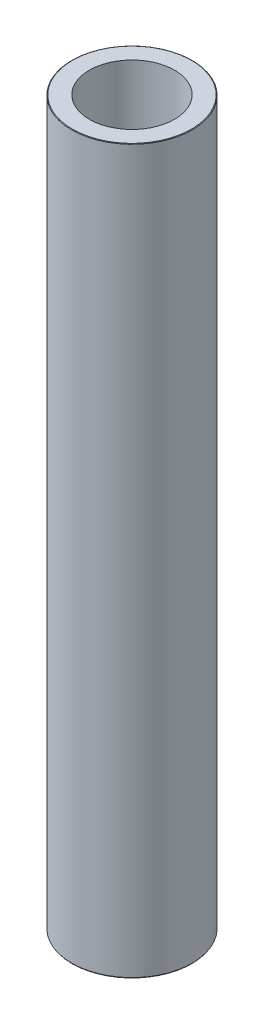
from build123d import *
from OCP.BRepFilletAPI import BRepFilletAPI_MakeChamfer

# Parameters (mm, degrees)
SKETCH1_R           = 50
BOSS_EXTRUDE1_DEPTH = 600
SKETCH2_R           = 35.353300363
CUT_EXTRUDE1_DEPTH  = 605.15229868
CHAMFER1_SIZE       = 0.3088358
CHAMFER1_SIZE2      = 0.534919297


with BuildPart() as part:
    # Sketch1 → Boss-Extrude1 (new body)
    with BuildSketch(Plane(origin=(0, 0, 0), x_dir=(1, 0, 0), z_dir=(0, 1, 0))):
        Circle(SKETCH1_R)
    extrude(amount=BOSS_EXTRUDE1_DEPTH)

    # Sketch2 → Cut-Extrude1 (cut, through all)
    with BuildSketch(Plane(origin=(0, 0, 0), x_dir=(1, 0, 0), z_dir=(0, 1, 0))):
        Circle(SKETCH2_R)
    extrude(amount=CUT_EXTRUDE1_DEPTH, mode=Mode.SUBTRACT)

    # Chamfer1: one chamfer whose edges measure the first distance from different faces: ONE call of the kernel's chamfer builder (chamfer() names one face for all edges)
    chamfer1_edges_1 = [part.edges().sort_by_distance(p)[0] for p in [
        (-50, 600, 0),
    ]]
    chamfer1_side_1 = [part.faces().sort_by_distance(p)[0] for p in [
        (-50, 300, 0),
    ]]
    chamfer1_edges_2 = [part.edges().sort_by_distance(p)[0] for p in [
        (-50, 0, 0),
    ]]
    chamfer1_side_2 = [part.faces().sort_by_distance(p)[0] for p in [
        (-48.585786438, 0, 0),
    ]]
    chamfer1 = BRepFilletAPI_MakeChamfer(part.part.solid().wrapped)
    for e in chamfer1_edges_1:
        chamfer1.Add(CHAMFER1_SIZE, CHAMFER1_SIZE2, e.wrapped, chamfer1_side_1[0].wrapped)  # the first distance lies on this face
    for e in chamfer1_edges_2:
        chamfer1.Add(CHAMFER1_SIZE, CHAMFER1_SIZE2, e.wrapped, chamfer1_side_2[0].wrapped)  # the first distance lies on this face
    add(Compound.cast(chamfer1.Shape()), mode=Mode.REPLACE)


solid = part.part
